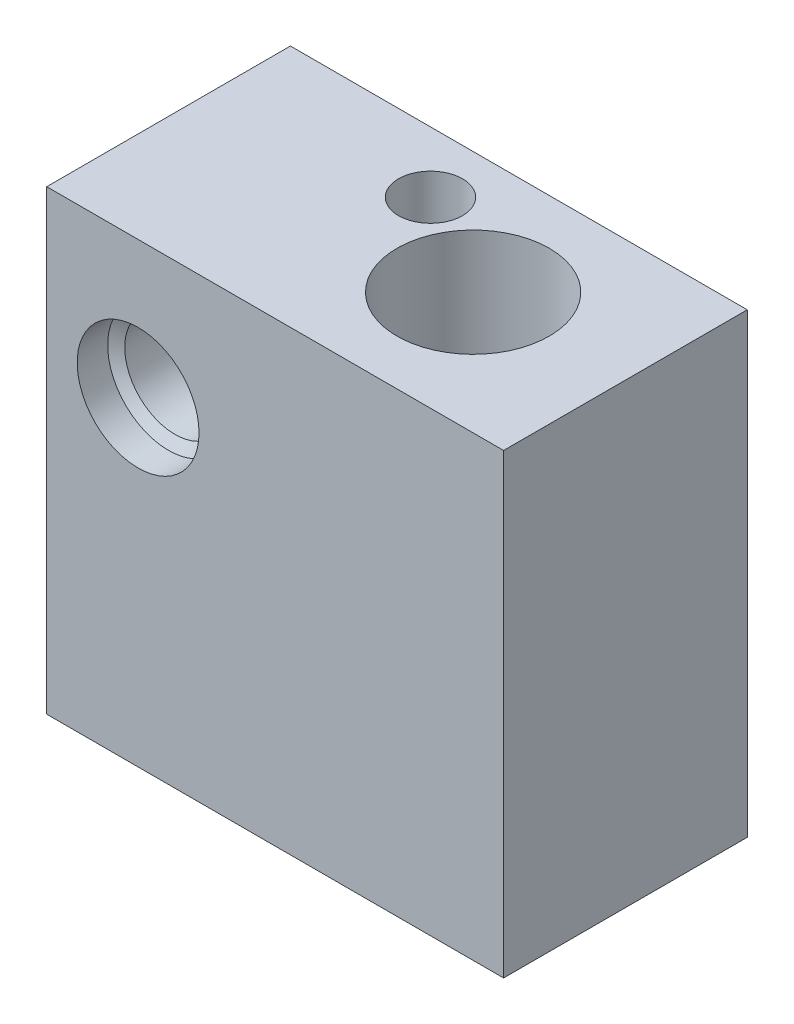
from build123d import *

# Parameters (mm, degrees)
SKETCH1_W                    = 15
SKETCH1_H                    = 15
SKETCH1_R                    = 1.65
BOSS_EXTRUDE1_DEPTH          = 8
SKETCH2_R                    = 2.5
CUT_EXTRUDE1_DEPTH           = 21.808652047
SKETCH3_R                    = 1.05
CUT_EXTRUDE2_DEPTH           = 21.808652047
F_4_0_4_DIAMETER_HOLE1_D     = 4
F_4_0_4_DIAMETER_HOLE1_DEPTH = 1
F_4_0_4_DIAMETER_HOLE1_TIP   = 1.201721238


with BuildPart() as part:
    # Sketch1 → Boss-Extrude1 (new body)
    with BuildSketch(Plane.XY):
        with Locations((4.5, -3)):
            Rectangle(SKETCH1_W, SKETCH1_H)
        Circle(SKETCH1_R, mode=Mode.SUBTRACT)
    extrude(amount=BOSS_EXTRUDE1_DEPTH)

    # Sketch2 → Cut-Extrude1 (cut, through all)
    with BuildSketch(Plane.XZ.offset(10.5)):
        with Locations((7, 4)):
            Circle(SKETCH2_R)
    extrude(amount=-CUT_EXTRUDE1_DEPTH, mode=Mode.SUBTRACT)

    # Sketch3 → Cut-Extrude2 (cut, through all)
    with BuildSketch(Plane.XZ.offset(10.5)):
        with Locations((3.6, 2)):
            Circle(SKETCH3_R)
    extrude(amount=-CUT_EXTRUDE2_DEPTH, mode=Mode.SUBTRACT)

    # Ø4.0 (4) Diameter Hole1
    with Locations(Plane.XY.offset(8)):
        with Locations((0, 0)):
            Hole(F_4_0_4_DIAMETER_HOLE1_D / 2, depth=F_4_0_4_DIAMETER_HOLE1_DEPTH)
            with Locations((0, 0, -(F_4_0_4_DIAMETER_HOLE1_DEPTH + F_4_0_4_DIAMETER_HOLE1_TIP / 2))):  # 118° drill point
                Cone(0, F_4_0_4_DIAMETER_HOLE1_D / 2, F_4_0_4_DIAMETER_HOLE1_TIP, mode=Mode.SUBTRACT)


solid = part.part
